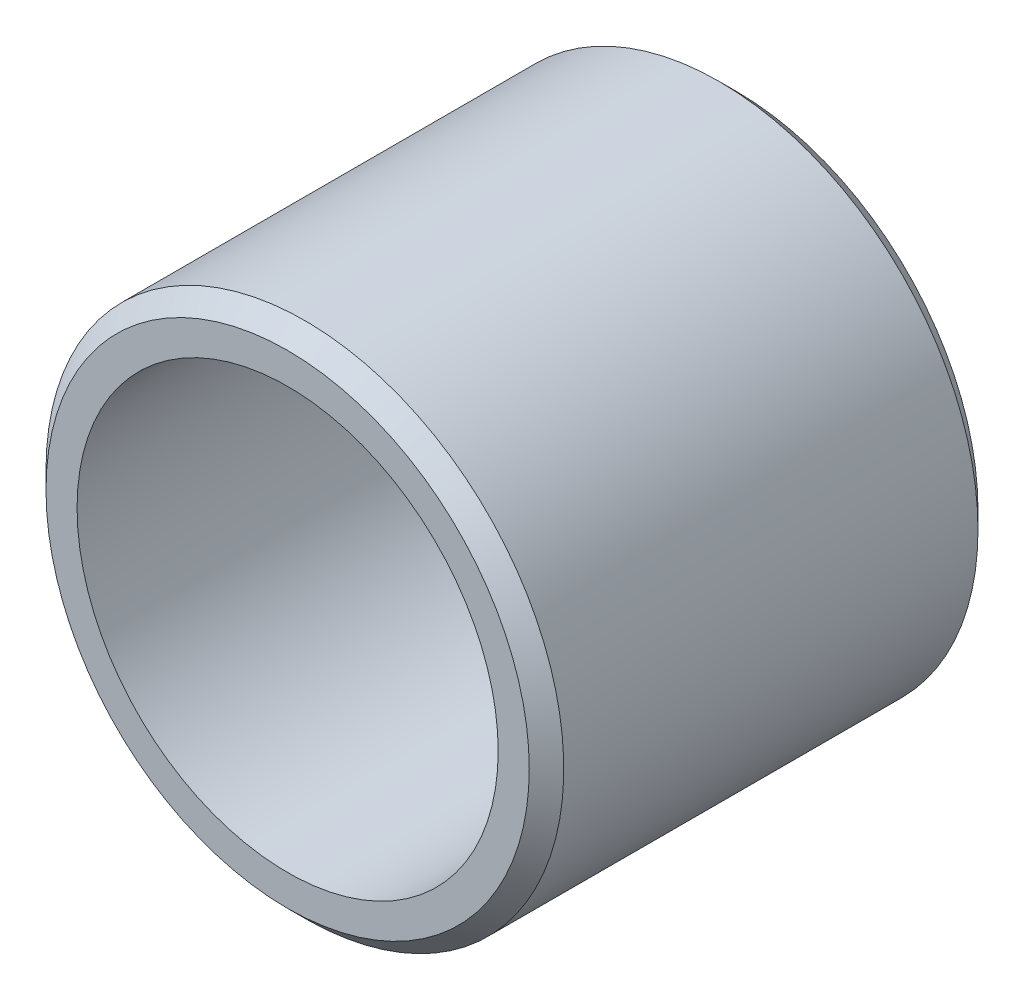
from build123d import *

# Parameters (mm, degrees)
SKETCH2_R           = 7.5
SKETCH2_R_2         = 6.1
BOSS_EXTRUDE1_DEPTH = 13
CHAMFER1_SIZE       = 0.5


with BuildPart() as part:
    # Sketch2 → Boss-Extrude1 (new body)
    with BuildSketch(Plane.XY):
        Circle(SKETCH2_R)
        Circle(SKETCH2_R_2, mode=Mode.SUBTRACT)
    extrude(amount=BOSS_EXTRUDE1_DEPTH)

    # Chamfer1
    chamfer1_edges = [part.edges().sort_by_distance(p)[0] for p in [
        (-7.5, 0, 0),
        (-7.5, 0, 13),
    ]]
    chamfer(chamfer1_edges, length=CHAMFER1_SIZE)


solid = part.part
